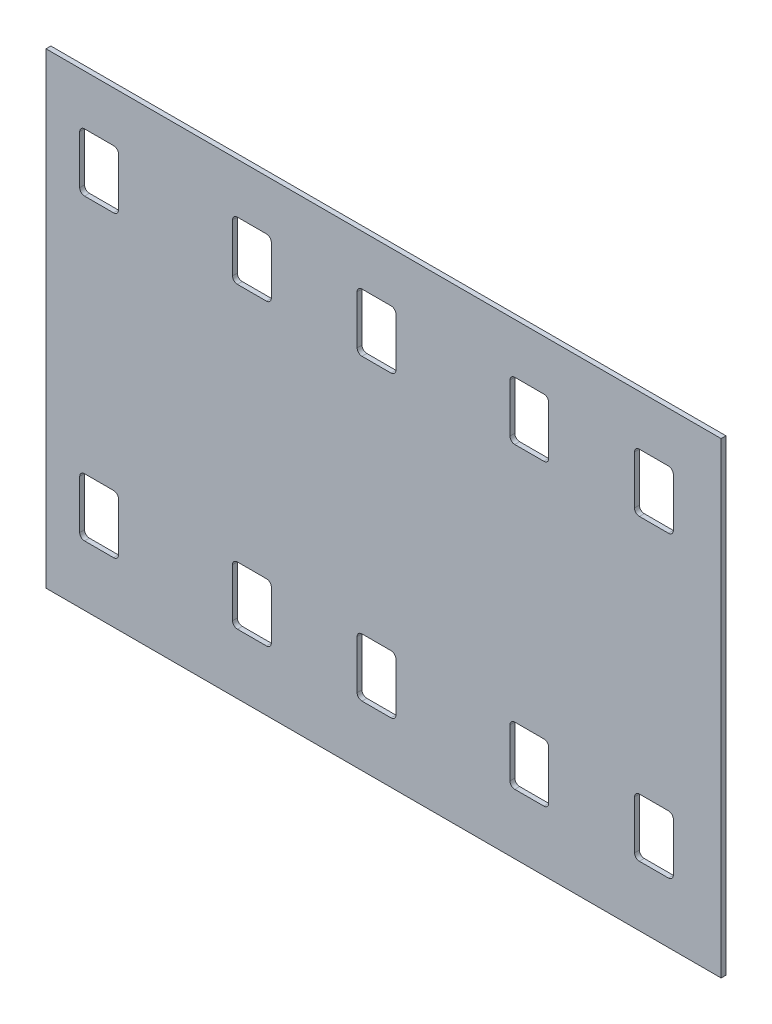
from build123d import *

# Parameters (mm, degrees)
SKETCH1_W           = 441.979400076
SKETCH1_H           = 305.81676
BOSS_EXTRUDE1_DEPTH = 3.175
CUT_EXTRUDE1_DEPTH  = 271.654843319
CUT_EXTRUDE2_DEPTH  = 271.654843319
LPATTERN1_COUNT     = 3
LPATTERN1_PITCH     = 181.613999992
LPATTERN2_COUNT     = 2
LPATTERN2_PITCH     = 181.613999992


with BuildPart() as part:
    # Sketch1 → Boss-Extrude1 (new body)
    with BuildSketch(Plane.XY):
        with Locations((0, -3.32067)):
            Rectangle(SKETCH1_W, SKETCH1_H)
    extrude(amount=BOSS_EXTRUDE1_DEPTH)

    # Sketch2 → Cut-Extrude1 (cut, through all)
    with BuildSketch(Plane.XY.offset(3.175)):
        with BuildLine():
            Line((-176.7105, 116.8), (-195.7605, 116.8))
            ThreePointArc((-195.7605, 116.8), (-198.00556403, 115.87006403), (-198.9355, 113.625))
            Line((-198.9355, 113.625), (-198.9355, 81.875))
            ThreePointArc((-198.9355, 81.875), (-198.00556403, 79.62993597), (-195.7605, 78.7))
            Line((-195.7605, 78.7), (-176.7105, 78.7))
            ThreePointArc((-176.7105, 78.7), (-174.46543597, 79.62993597), (-173.5355, 81.875))
            Line((-173.5355, 81.875), (-173.5355, 113.625))
            ThreePointArc((-173.5355, 113.625), (-174.46543597, 115.87006403), (-176.7105, 116.8))
        make_face()
        with BuildLine():
            Line((-176.7105, -78.7), (-195.7605, -78.7))
            ThreePointArc((-195.7605, -78.7), (-198.00556403, -79.62993597), (-198.9355, -81.875))
            Line((-198.9355, -81.875), (-198.9355, -113.625))
            ThreePointArc((-198.9355, -113.625), (-198.00556403, -115.87006403), (-195.7605, -116.8))
            Line((-195.7605, -116.8), (-176.7105, -116.8))
            ThreePointArc((-176.7105, -116.8), (-174.46543597, -115.87006403), (-173.5355, -113.625))
            Line((-173.5355, -113.625), (-173.5355, -81.875))
            ThreePointArc((-173.5355, -81.875), (-174.46543597, -79.62993597), (-176.7105, -78.7))
        make_face()
    cut_extrude1 = extrude(amount=-CUT_EXTRUDE1_DEPTH, mode=Mode.SUBTRACT)

    # Sketch3 → Cut-Extrude2 (cut, through all)
    with BuildSketch(Plane.XY.offset(3.175)):
        with BuildLine():
            ThreePointArc((-73.4905, 113.625), (-74.42043597, 115.87006403), (-76.6655, 116.8))
            Line((-76.6655, 116.8), (-95.7155, 116.8))
            ThreePointArc((-95.7155, 116.8), (-97.96056403, 115.87006403), (-98.8905, 113.625))
            Line((-98.8905, 113.625), (-98.8905, 81.875))
            ThreePointArc((-98.8905, 81.875), (-97.96056403, 79.62993597), (-95.7155, 78.7))
            Line((-95.7155, 78.7), (-76.6655, 78.7))
            ThreePointArc((-76.6655, 78.7), (-74.42043597, 79.62993597), (-73.4905, 81.875))
            Line((-73.4905, 81.875), (-73.4905, 113.625))
        make_face()
        with BuildLine():
            ThreePointArc((-98.8905, -113.625), (-97.96056403, -115.87006403), (-95.7155, -116.8))
            Line((-95.7155, -116.8), (-76.6655, -116.8))
            ThreePointArc((-76.6655, -116.8), (-74.42043597, -115.87006403), (-73.4905, -113.625))
            Line((-73.4905, -113.625), (-73.4905, -81.875))
            ThreePointArc((-73.4905, -81.875), (-74.42043597, -79.62993597), (-76.6655, -78.7))
            Line((-76.6655, -78.7), (-95.7155, -78.7))
            ThreePointArc((-95.7155, -78.7), (-97.96056403, -79.62993597), (-98.8905, -81.875))
            Line((-98.8905, -81.875), (-98.8905, -113.625))
        make_face()
    cut_extrude2 = extrude(amount=-CUT_EXTRUDE2_DEPTH, mode=Mode.SUBTRACT)

    # LPattern1: Cut-Extrude1 ×3
    with Locations(*[(i * LPATTERN1_PITCH, 0, 0) for i in range(1, LPATTERN1_COUNT)]):
        add(cut_extrude1, mode=Mode.SUBTRACT)

    # LPattern2: Cut-Extrude2 ×2
    with Locations(*[(i * LPATTERN2_PITCH, 0, 0) for i in range(1, LPATTERN2_COUNT)]):
        add(cut_extrude2, mode=Mode.SUBTRACT)


solid = part.part
